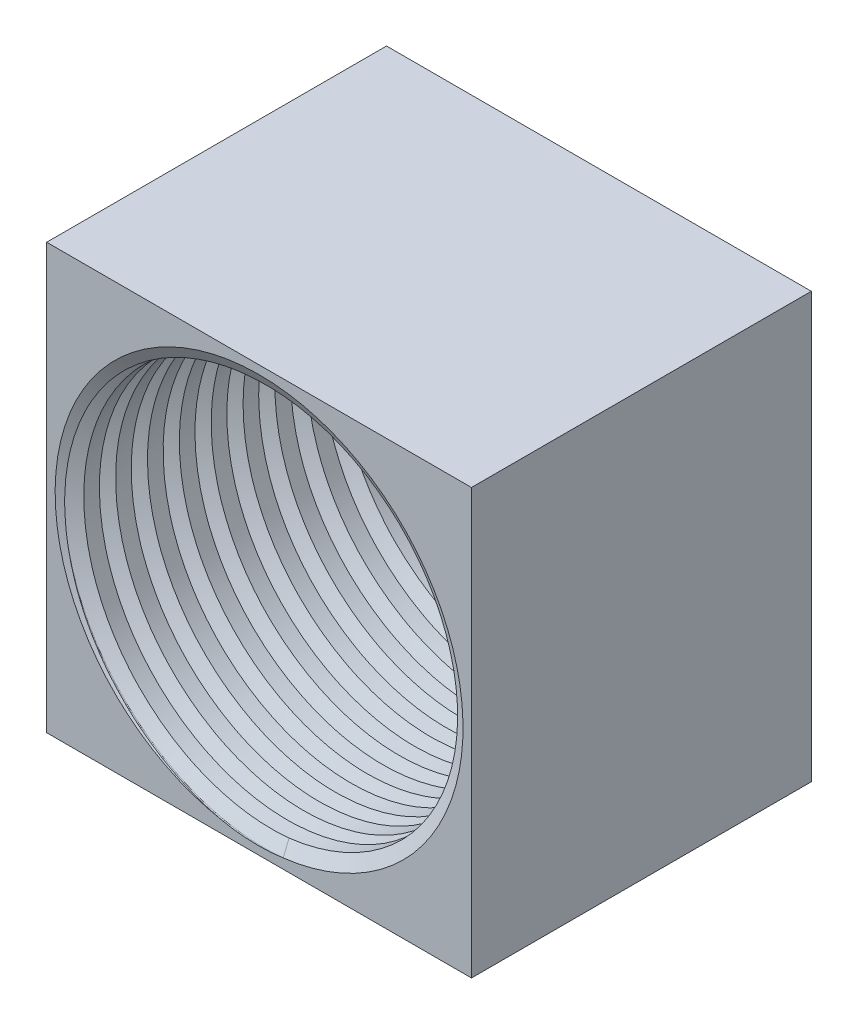
from build123d import *

# Parameters (mm, degrees)
SKETCH1_W           = 10
SKETCH1_H           = 10
BOSS_EXTRUDE1_DEPTH = 8
CUT_EXTRUDE1_REACH  = 18.248
SKETCH2_R           = 4.5
CUT_SWEEP9_PITCH    = 0.75


with BuildPart() as part:
    # Sketch1 → Boss-Extrude1 (new body)
    with BuildSketch(Plane.XY):
        with Locations((5, 5)):
            Rectangle(SKETCH1_W, SKETCH1_H)
    extrude(amount=BOSS_EXTRUDE1_DEPTH)

    # Sketch2 → Cut-Extrude1 (cut, up to next)
    with BuildSketch(Plane.XY.offset(8), mode=Mode.PRIVATE) as cut_extrude1_sk1:
        with Locations((5, 5)):
            Circle(SKETCH2_R)
    cut_extrude1_tool1 = extrude(cut_extrude1_sk1.sketch, amount=-CUT_EXTRUDE1_REACH, mode=Mode.PRIVATE) & part.part
    add(cut_extrude1_tool1.solids().sort_by_distance((5, 5, 8))[0], mode=Mode.SUBTRACT)

    # Cut-Sweep9: the profile of Sketch22 profile screwed along a right-hand helix of 11 turns, 8 arcs to a turn; built about Z, then put on its axis
    cut_sweep9_z = Axis((0, 0, 0), (0, 0, 1))
    cut_sweep9_corners = [(4.4997, 0, -0.382379083), (4.4997, 0, 0.000173205), (4.801, 0, -0.173782431), (4.811, 0, -0.191102939), (4.801, 0, -0.208423447)]
    with BuildLine(mode=Mode.PRIVATE) as cut_sweep9_profile:
        Line(cut_sweep9_corners[0], cut_sweep9_corners[1])
        Line(cut_sweep9_corners[1], cut_sweep9_corners[2])
        Line(cut_sweep9_corners[4], cut_sweep9_corners[0])
        ThreePointArc((4.801, 0, -0.173782431), (4.808320508, 0, -0.181102939), (4.811, 0, -0.191102939))
        ThreePointArc((4.811, 0, -0.191102939), (4.808320508, 0, -0.201102939), (4.801, 0, -0.208423447))
    cut_sweep9_cap = Face(cut_sweep9_profile.wire())
    cut_sweep9_arcs = [((4.801, 0, -0.173782431), (4.811, 0, -0.179555934), (4.811, 0, -0.191102939), (1, 0.8660254037844358, 1)), ((4.811, 0, -0.191102939), (4.811, 0, -0.202649944), (4.801, 0, -0.208423447), (1, 0.8660254037844358, 1))]  # start, shoulder, end, weights
    cut_sweep9_turn_angles = [0, 22.5, 45, 67.5, 90, 112.5, 135, 157.5, 180, 202.5, 225, 247.5, 270, 292.5, 315, 337.5, 360]
    cut_sweep9_turn_weights = [1, 0.9238795325112867, 1, 0.9238795325112867, 1, 0.9238795325112867, 1, 0.9238795325112867, 1, 0.9238795325112867, 1, 0.9238795325112867, 1, 0.9238795325112867, 1, 0.9238795325112867, 1]
    cut_sweep9_turn_rails = [Edge.make_bspline([Vector(p[0], p[1], 0).rotate(cut_sweep9_z, cut_sweep9_turn_angles[k]) / cut_sweep9_turn_weights[k] + Vector(0, 0, p[2] + CUT_SWEEP9_PITCH * cut_sweep9_turn_angles[k] / 360) for k in range(17)], [0, 0, 0, 1, 1, 2, 2, 3, 3, 4, 4, 5, 5, 6, 6, 7, 7, 8, 8, 8], 2, cut_sweep9_turn_weights) for p in cut_sweep9_corners]
    cut_sweep9_turn_sides = [*[Face.make_surface_from_curves(cut_sweep9_turn_rails[p[0]], cut_sweep9_turn_rails[p[1]]) for p in [(0, 1), (1, 2), (4, 0)]], *[Face.make_bezier_surface([[Vector(p[j][0], p[j][1], 0).rotate(cut_sweep9_z, cut_sweep9_turn_angles[2 * i + k]) / cut_sweep9_turn_weights[2 * i + k] + Vector(0, 0, p[j][2] + CUT_SWEEP9_PITCH * cut_sweep9_turn_angles[2 * i + k] / 360) for k in range(3)] for j in range(3)], [[p[3][j] * cut_sweep9_turn_weights[2 * i + k] for k in range(3)] for j in range(3)]) for p in cut_sweep9_arcs for i in range(8)]]
    cut_sweep9 = Plane(origin=(5, 5, 8), x_dir=(1, 0, 0), z_dir=(0, 0, -1)) * Solid(Shell([*[p.moved(Location((0, 0, CUT_SWEEP9_PITCH * i))) for i in range(11) for p in cut_sweep9_turn_sides], cut_sweep9_cap, cut_sweep9_cap.rotate(cut_sweep9_z, 3960).moved(Location((0, 0, CUT_SWEEP9_PITCH * 3960 / 360)))]))
    add(cut_sweep9, mode=Mode.SUBTRACT)

    # Cut-Extrude2 cone 1 section (through the dimple's axis) → Cut-Extrude2 (revolve, cut)
    with BuildSketch(Plane(origin=(5, 5, 8), x_dir=(0, -1, 0), z_dir=(1, 0, 0))):
        Polygon((0, 0), (4.801, 0), (0, 2.771858642), align=None)
    revolve(axis=Axis((5, 5, 8), (0, 0, -1)), mode=Mode.SUBTRACT)

    # Cut-Extrude3 cone 1 section (through the dimple's axis) → Cut-Extrude3 (revolve, cut)
    with BuildSketch(Plane(origin=(5, 5, 0), x_dir=(0, 1, 0), z_dir=(1, 0, 0))):
        Polygon((0, 0), (4.801, 0), (0, 2.771858642), align=None)
    revolve(axis=Axis((5, 5, 0), (0, 0, 1)), mode=Mode.SUBTRACT)


solid = part.part
